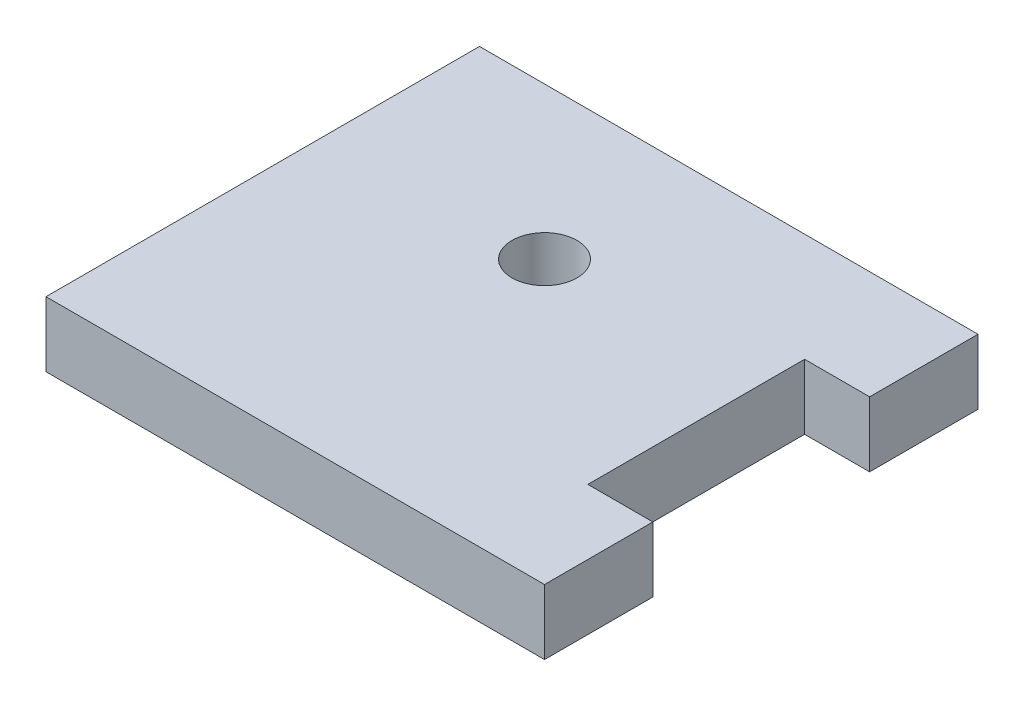
from build123d import *

# Parameters (mm, degrees)
SKETCH1_R           = 1.5
BOSS_EXTRUDE1_DEPTH = 3


with BuildPart() as part:
    # Sketch1 → Boss-Extrude1 (new body)
    with BuildSketch(Plane(origin=(0, 0, 0), x_dir=(1, 0, 0), z_dir=(0, 1, 0))):
        Polygon((0, 0), (20, 0), (23, 0), (23, 5), (20, 5), (20, 15), (23, 15), (23, 20), (20, 20), (0, 20), align=None)
        with Locations((10, 13)):
            Circle(SKETCH1_R, mode=Mode.SUBTRACT)
    extrude(amount=BOSS_EXTRUDE1_DEPTH)


solid = part.part
